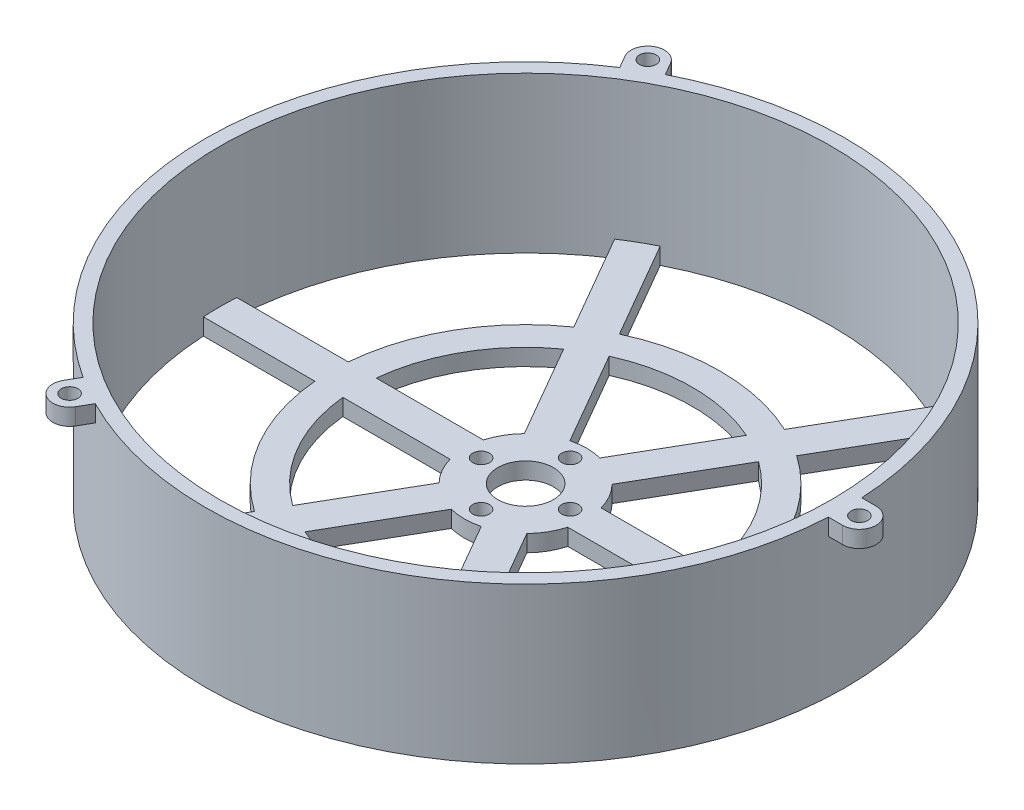
from build123d import *
from build123d.topology import SkipClean

# Parameters (mm, degrees)
SKETCH_1_R          = 1.5
SKETCH_1_R_2        = 5
EXTRUDE_1_DEPTH     = 3
SKETCH_2_R          = 57.5
SKETCH_2_R_2        = 55
EXTRUDE_2_DEPTH     = 25
EXTRUDE_START       = -3
SKETCH_3_R          = 1.5
EXTRUDE_3_DEPTH     = 3
CUT_EXTRUDE_START   = -30
SKETCH_4_R          = 69.475087651
SKETCH_4_R_2        = 57.5
CUT_EXTRUDE_1_DEPTH = 30


with BuildPart() as part:
    # 草图1 → 凸台-拉伸1 (new body)
    with BuildSketch(Plane(origin=(0, 0, 0), x_dir=(1, 0, 0), z_dir=(0, 1, 0))):
        with BuildLine():
            Line((57.421685799, 3), (60, 3))
            ThreePointArc((60, 3), (63, 0), (60, -3))
            Line((60, -3), (57.421685799, -3))
            ThreePointArc((57.421685799, -3), (28.75, -49.796460718), (-26.112766688, -51.22863863))
            Line((-26.112766688, -51.22863863), (-27.401923789, -53.461524227))
            ThreePointArc((-27.401923789, -53.461524227), (-31.5, -54.559600438), (-32.598076211, -50.461524227))
            Line((-32.598076211, -50.461524227), (-31.308919111, -48.22863863))
            ThreePointArc((-31.308919111, -48.22863863), (-57.5, 0), (-31.308919111, 48.22863863))
            Line((-31.308919111, 48.22863863), (-32.598076211, 50.461524227))
            ThreePointArc((-32.598076211, 50.461524227), (-31.5, 54.559600438), (-27.401923789, 53.461524227))
            Line((-27.401923789, 53.461524227), (-26.112766688, 51.22863863))
            ThreePointArc((-26.112766688, 51.22863863), (28.75, 49.796460718), (57.421685799, 3))
        make_face()
        with Locations((0, 8)):
            Circle(SKETCH_1_R, mode=Mode.SUBTRACT)
        with Locations((8, 0)):
            Circle(SKETCH_1_R, mode=Mode.SUBTRACT)
        with Locations((0, -8)):
            Circle(SKETCH_1_R, mode=Mode.SUBTRACT)
        with Locations((-8, 0)):
            Circle(SKETCH_1_R, mode=Mode.SUBTRACT)
        Circle(SKETCH_1_R_2, mode=Mode.SUBTRACT)
        with Locations((60, 0)):
            Circle(SKETCH_1_R, mode=Mode.SUBTRACT)
        with Locations((-30, -51.961524227)):
            Circle(SKETCH_1_R, mode=Mode.SUBTRACT)
        with Locations((-30, 51.961524227)):
            Circle(SKETCH_1_R, mode=Mode.SUBTRACT)
        with BuildLine():
            Line((10.583005244, 3), (29.849623113, 3))
            ThreePointArc((29.849623113, 3), (25.980762114, 15), (17.522887768, 24.350531909))
            Line((17.522887768, 24.350531909), (7.889578833, 7.66515139))
            ThreePointArc((7.889578833, 7.66515139), (9.526279442, 5.5), (10.583005244, 3))
        make_face(mode=Mode.SUBTRACT)
        with BuildLine():
            Line((10.583005244, -3), (29.849623113, -3))
            ThreePointArc((29.849623113, -3), (25.980762114, -15), (17.522887768, -24.350531909))
            Line((17.522887768, -24.350531909), (7.889578833, -7.66515139))
            ThreePointArc((7.889578833, -7.66515139), (9.526279442, -5.5), (10.583005244, -3))
        make_face(mode=Mode.SUBTRACT)
        with BuildLine():
            Line((2.693426411, -10.66515139), (12.326735345, -27.350531909))
            ThreePointArc((12.326735345, -27.350531909), (0, -30), (-12.326735345, -27.350531909))
            Line((-12.326735345, -27.350531909), (-2.693426411, -10.66515139))
            ThreePointArc((-2.693426411, -10.66515139), (0, -11), (2.693426411, -10.66515139))
        make_face(mode=Mode.SUBTRACT)
        with BuildLine():
            Line((-14.837519563, 31.699337741), (-24.860984224, 49.060487802))
            ThreePointArc((-24.860984224, 49.060487802), (0, 55), (24.860984224, 49.060487802))
            Line((24.860984224, 49.060487802), (14.837519563, 31.699337741))
            ThreePointArc((14.837519563, 31.699337741), (0, 35), (-14.837519563, 31.699337741))
        make_face(mode=Mode.SUBTRACT)
        with BuildLine():
            Line((-7.889578833, -7.66515139), (-17.522887768, -24.350531909))
            ThreePointArc((-17.522887768, -24.350531909), (-25.980762114, -15), (-29.849623113, -3))
            Line((-29.849623113, -3), (-10.583005244, -3))
            ThreePointArc((-10.583005244, -3), (-9.526279442, -5.5), (-7.889578833, -7.66515139))
        make_face(mode=Mode.SUBTRACT)
        with BuildLine():
            Line((-10.583005244, 3), (-29.849623113, 3))
            ThreePointArc((-29.849623113, 3), (-25.980762114, 15), (-17.522887768, 24.350531909))
            Line((-17.522887768, 24.350531909), (-7.889578833, 7.66515139))
            ThreePointArc((-7.889578833, 7.66515139), (-9.526279442, 5.5), (-10.583005244, 3))
        make_face(mode=Mode.SUBTRACT)
        with BuildLine():
            Line((20.033671986, 28.699337741), (30.057136647, 46.060487802))
            ThreePointArc((30.057136647, 46.060487802), (47.631397208, 27.5), (54.918120871, 3))
            Line((54.918120871, 3), (34.871191548, 3))
            ThreePointArc((34.871191548, 3), (30.310889132, 17.5), (20.033671986, 28.699337741))
        make_face(mode=Mode.SUBTRACT)
        with BuildLine():
            Line((-20.033671986, 28.699337741), (-30.057136647, 46.060487802))
            ThreePointArc((-30.057136647, 46.060487802), (-47.631397208, 27.5), (-54.918120871, 3))
            Line((-54.918120871, 3), (-34.871191548, 3))
            ThreePointArc((-34.871191548, 3), (-30.310889132, 17.5), (-20.033671986, 28.699337741))
        make_face(mode=Mode.SUBTRACT)
        with BuildLine():
            Line((-2.693426411, 10.66515139), (-12.326735345, 27.350531909))
            ThreePointArc((-12.326735345, 27.350531909), (0, 30), (12.326735345, 27.350531909))
            Line((12.326735345, 27.350531909), (2.693426411, 10.66515139))
            ThreePointArc((2.693426411, 10.66515139), (0, 11), (-2.693426411, 10.66515139))
        make_face(mode=Mode.SUBTRACT)
        with BuildLine():
            Line((-34.871191548, -3), (-54.918120871, -3))
            ThreePointArc((-54.918120871, -3), (-47.631397208, -27.5), (-30.057136647, -46.060487802))
            Line((-30.057136647, -46.060487802), (-20.033671986, -28.699337741))
            ThreePointArc((-20.033671986, -28.699337741), (-30.310889132, -17.5), (-34.871191548, -3))
        make_face(mode=Mode.SUBTRACT)
        with BuildLine():
            Line((34.871191548, -3), (54.918120871, -3))
            ThreePointArc((54.918120871, -3), (47.631397208, -27.5), (30.057136647, -46.060487802))
            Line((30.057136647, -46.060487802), (20.033671986, -28.699337741))
            ThreePointArc((20.033671986, -28.699337741), (30.310889132, -17.5), (34.871191548, -3))
        make_face(mode=Mode.SUBTRACT)
        with BuildLine():
            Line((14.837519563, -31.699337741), (24.860984224, -49.060487802))
            ThreePointArc((24.860984224, -49.060487802), (0, -55), (-24.860984224, -49.060487802))
            Line((-24.860984224, -49.060487802), (-14.837519563, -31.699337741))
            ThreePointArc((-14.837519563, -31.699337741), (0, -35), (14.837519563, -31.699337741))
        make_face(mode=Mode.SUBTRACT)
    extrude(amount=EXTRUDE_1_DEPTH)

    # 草图2 → 凸台-拉伸2 (add)
    with SkipClean():  # the faces are left unmerged after this step: merging them gives an invalid solid
        with BuildSketch(Plane(origin=(0, 3, 0), x_dir=(1, 0, 0), z_dir=(0, 1, 0))):
            Circle(SKETCH_2_R)
            Circle(SKETCH_2_R_2, mode=Mode.SUBTRACT)
        extrude(amount=EXTRUDE_2_DEPTH)
    add(part.part.scale(1), mode=Mode.REPLACE)  # the faces are merged on a copy

    # 草图3 → 凸台-拉伸3 (add)
    # profile 1 of 3: a face of its own
    with SkipClean():  # the faces are left unmerged after this step: merging them gives an invalid solid
        with BuildSketch(Plane(origin=(0, 28, 0), x_dir=(1, 0, 0), z_dir=(0, 1, 0)).offset(EXTRUDE_START)):
            with BuildLine():
                Line((-32.598076211, 50.461524227), (-31.308919111, 48.22863863))
                ThreePointArc((-31.308919111, 48.22863863), (-28.75, 49.796460718), (-26.112766688, 51.22863863))
                Line((-26.112766688, 51.22863863), (-27.401923789, 53.461524227))
                ThreePointArc((-27.401923789, 53.461524227), (-31.5, 54.559600438), (-32.598076211, 50.461524227))
            make_face()
            with Locations((-30, 51.961524227)):
                Circle(SKETCH_3_R, mode=Mode.SUBTRACT)
        # profile 2 of 3: a face of its own
        with BuildSketch(Plane(origin=(0, 28, 0), x_dir=(1, 0, 0), z_dir=(0, 1, 0)).offset(EXTRUDE_START)):
            with BuildLine():
                Line((60, 3), (57.421685799, 3))
                ThreePointArc((57.421685799, 3), (57.5, 0), (57.421685799, -3))
                Line((57.421685799, -3), (60, -3))
                ThreePointArc((60, -3), (63, 0), (60, 3))
            make_face()
            with Locations((60, 0)):
                Circle(SKETCH_3_R, mode=Mode.SUBTRACT)
        # profile 3 of 3: a face of its own
        with BuildSketch(Plane(origin=(0, 28, 0), x_dir=(1, 0, 0), z_dir=(0, 1, 0)).offset(EXTRUDE_START)):
            with BuildLine():
                Line((-27.401923789, -53.461524227), (-26.112766688, -51.22863863))
                ThreePointArc((-26.112766688, -51.22863863), (-28.75, -49.796460718), (-31.308919111, -48.22863863))
                Line((-31.308919111, -48.22863863), (-32.598076211, -50.461524227))
                ThreePointArc((-32.598076211, -50.461524227), (-31.5, -54.559600438), (-27.401923789, -53.461524227))
            make_face()
            with Locations((-30, -51.961524227)):
                Circle(SKETCH_3_R, mode=Mode.SUBTRACT)
        extrude(amount=EXTRUDE_3_DEPTH)

    # 草图4 → 切除-拉伸1 (cut)
    with BuildSketch(Plane(origin=(0, 3, 0), x_dir=(1, 0, 0), z_dir=(0, 1, 0)).offset(CUT_EXTRUDE_START)):
        Circle(SKETCH_4_R)
        Circle(SKETCH_4_R_2, mode=Mode.SUBTRACT)
    extrude(amount=CUT_EXTRUDE_1_DEPTH, mode=Mode.SUBTRACT)


solid = part.part
